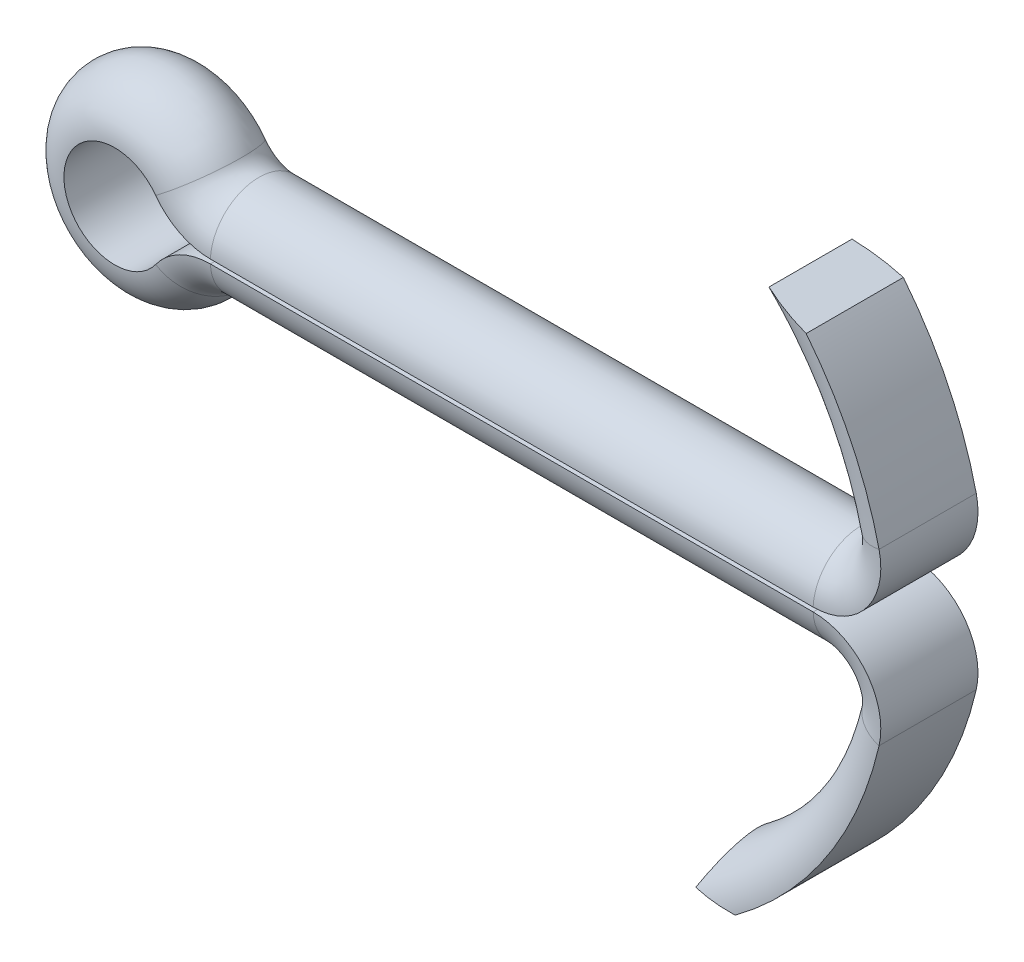
from build123d import *

# Parameters (mm, degrees)
STRUCTURAL_MEMBER1_ANGLE   = 46.961343
STRUCTURAL_MEMBER1_2_ANGLE = 103.038657
STRUCTURAL_START           = -14.25
STRUCTURAL_MEMBER1_3_DEPTH = 28.5
STRUCTURAL_MEMBER1_4_ANGLE = 53.893663
STRUCTURAL_MEMBER1_5_ANGLE = 287.787327
STRUCTURAL_MEMBER1_6_ANGLE = 53.893663
STRUCTURAL_MEMBER1_7_DEPTH = 28.5
STRUCTURAL_MEMBER1_8_ANGLE = 103.038657
STRUCTURAL_MEMBER1_9_ANGLE = 31.961343
EXTRUDE1_DEPTH             = 29.106869247
EXTRUDE1_DEPTH_BACK        = 29.106869247


# Read off the part's stored shape, not the designer's step: Structural Member1
with BuildPart() as part:
    # Structural Member1 outline → Structural Member1 (revolve)
    with BuildSketch(Plane(origin=(0, 0, 0), x_dir=(0.5000000000000149, -0.86602540378443, 0), z_dir=(-0.86602540378443, -0.5000000000000149, 0))):
        with BuildLine():
            ThreePointArc((17.827115232, 2.297825059), (15.627115232, 0), (17.827115232, -2.297825059))
            Line((17.827115232, -2.297825059), (17.827115232, 2.297825059))
        make_face()
    revolve(axis=Axis((0, 0, 0), (0, 0, 1)), revolution_arc=STRUCTURAL_MEMBER1_ANGLE)


with BuildPart() as body_2:
    # Structural Member1 2 outline → Structural Member1 2 (revolve)
    with BuildSketch(Plane(origin=(14.25, -3.3, 0), x_dir=(0.974218072006789, -0.2256083956225363, 0), z_dir=(-0.2256083956225363, -0.974218072006789, 0))):
        with BuildLine():
            ThreePointArc((3.2, 2.297825059), (1, 0), (3.2, -2.297825059))
            Line((3.2, -2.297825059), (3.2, 2.297825059))
        make_face()
    revolve(axis=Axis((14.25, -3.3, 0), (0, 0, 1)), revolution_arc=STRUCTURAL_MEMBER1_2_ANGLE)


with BuildPart() as body_3:
    # Structural Member1 3 outline → Structural Member1 3 (new body)
    with BuildSketch(Plane.YZ.offset(STRUCTURAL_START)):
        with BuildLine():
            Line((-0.1, -2.297825059), (-0.1, 2.297825059))
            ThreePointArc((-0.1, 2.297825059), (-2.3, 0), (-0.1, -2.297825059))
        make_face()
    extrude(amount=STRUCTURAL_MEMBER1_3_DEPTH)


with BuildPart() as body_4:
    # Structural Member1 4 outline → Structural Member1 4 (revolve)
    with BuildSketch(Plane(origin=(-14.25, -3.3, 0), x_dir=(0, 1, 0), z_dir=(1, 0, 0))):
        with BuildLine():
            ThreePointArc((3.2, 2.297825059), (1, 0), (3.2, -2.297825059))
            Line((3.2, -2.297825059), (3.2, 2.297825059))
        make_face()
    revolve(axis=Axis((-14.25, -3.3, 0), (0, 0, 1)), revolution_arc=STRUCTURAL_MEMBER1_4_ANGLE)


with BuildPart() as body_5:
    # Structural Member1 5 outline → Structural Member1 5 (revolve)
    with BuildSketch(Plane(origin=(-18.77437841, 0, 0), x_dir=(0.8079247161331453, 0.5892857142856737, 0), z_dir=(0.5892857142856737, -0.8079247161331453, 0))):
        with BuildLine():
            Line((2.4, 2.297825059), (2.4, -2.297825059))
            ThreePointArc((2.4, -2.297825059), (4.6, 0), (2.4, 2.297825059))
        make_face()
    revolve(axis=Axis((-18.77437841, 0, 0), (0, 0, 1)), revolution_arc=STRUCTURAL_MEMBER1_5_ANGLE)


with BuildPart() as body_6:
    # Structural Member1 6 outline → Structural Member1 6 (revolve)
    with BuildSketch(Plane(origin=(-14.25, 3.3, 0), x_dir=(-0.8079247161331524, -0.5892857142856639, 0), z_dir=(-0.5892857142856639, 0.8079247161331524, 0))):
        with BuildLine():
            ThreePointArc((3.2, 2.297825059), (1, 0), (3.2, -2.297825059))
            Line((3.2, -2.297825059), (3.2, 2.297825059))
        make_face()
    revolve(axis=Axis((-14.25, 3.3, 0), (0, 0, 1)), revolution_arc=STRUCTURAL_MEMBER1_6_ANGLE)


with BuildPart() as body_7:
    # Structural Member1 7 outline → Structural Member1 7 (new body)
    with BuildSketch(Plane.YZ.offset(STRUCTURAL_START)):
        with BuildLine():
            ThreePointArc((0.1, -2.297825059), (2.3, 0), (0.1, 2.297825059))
            Line((0.1, 2.297825059), (0.1, -2.297825059))
        make_face()
    extrude(amount=STRUCTURAL_MEMBER1_7_DEPTH)


with BuildPart() as body_8:
    # Structural Member1 8 outline → Structural Member1 8 (revolve)
    with BuildSketch(Plane(origin=(14.25, 3.3, 0), x_dir=(0, -1, 0), z_dir=(-1, 0, 0))):
        with BuildLine():
            ThreePointArc((3.2, 2.297825059), (1, 0), (3.2, -2.297825059))
            Line((3.2, -2.297825059), (3.2, 2.297825059))
        make_face()
    revolve(axis=Axis((14.25, 3.3, 0), (0, 0, 1)), revolution_arc=STRUCTURAL_MEMBER1_8_ANGLE)


with BuildPart() as body_9:
    # Structural Member1 9 outline → Structural Member1 9 (revolve)
    with BuildSketch(Plane(origin=(0, 0, 0), x_dir=(0.9742180720067738, 0.22560839562260226, 0), z_dir=(0.22560839562260226, -0.9742180720067738, 0))):
        with BuildLine():
            ThreePointArc((17.827115232, 2.297825059), (15.627115232, 0), (17.827115232, -2.297825059))
            Line((17.827115232, -2.297825059), (17.827115232, 2.297825059))
        make_face()
    revolve(axis=Axis((0, 0, 0), (0, 0, 1)), revolution_arc=STRUCTURAL_MEMBER1_9_ANGLE)


with BuildPart() as extrude1_tool:
    # Sketch12 → Extrude1 (new, two sides: drawn at the far end of the back side and taken through both)
    with BuildSketch(Plane.XY.offset(-EXTRUDE1_DEPTH_BACK)):
        with BuildLine():
            Line((11.82785661, 11.82785661), (13.920323888, 11.136903534))
            ThreePointArc((13.920323888, 11.136903534), (10.361203328, 13.472473166), (12.275707333, 9.670250253))
            Line((12.275707333, 9.670250253), (11.82785661, 11.82785661))
        make_face()
        with BuildLine():
            Line((8.363557616, -14.486106723), (10.563557616, -14.360267685))
            ThreePointArc((10.563557616, -14.360267685), (6.521221246, -15.695086526), (9.354577812, -12.517931315))
            Line((9.354577812, -12.517931315), (8.363557616, -14.486106723))
        make_face()
    extrude(amount=EXTRUDE1_DEPTH + EXTRUDE1_DEPTH_BACK)


with BuildPart() as part_1:
    add(part.part)

    # Extrude1: cut by extrude1_tool
    add(extrude1_tool.part, mode=Mode.SUBTRACT)


with BuildPart() as body_9_1:
    add(body_9.part)

    # Extrude1: cut by extrude1_tool
    add(extrude1_tool.part, mode=Mode.SUBTRACT)


solid = Compound([body_2.part, body_3.part, body_4.part, body_5.part, body_6.part, body_7.part, body_8.part, part_1.part, body_9_1.part])
